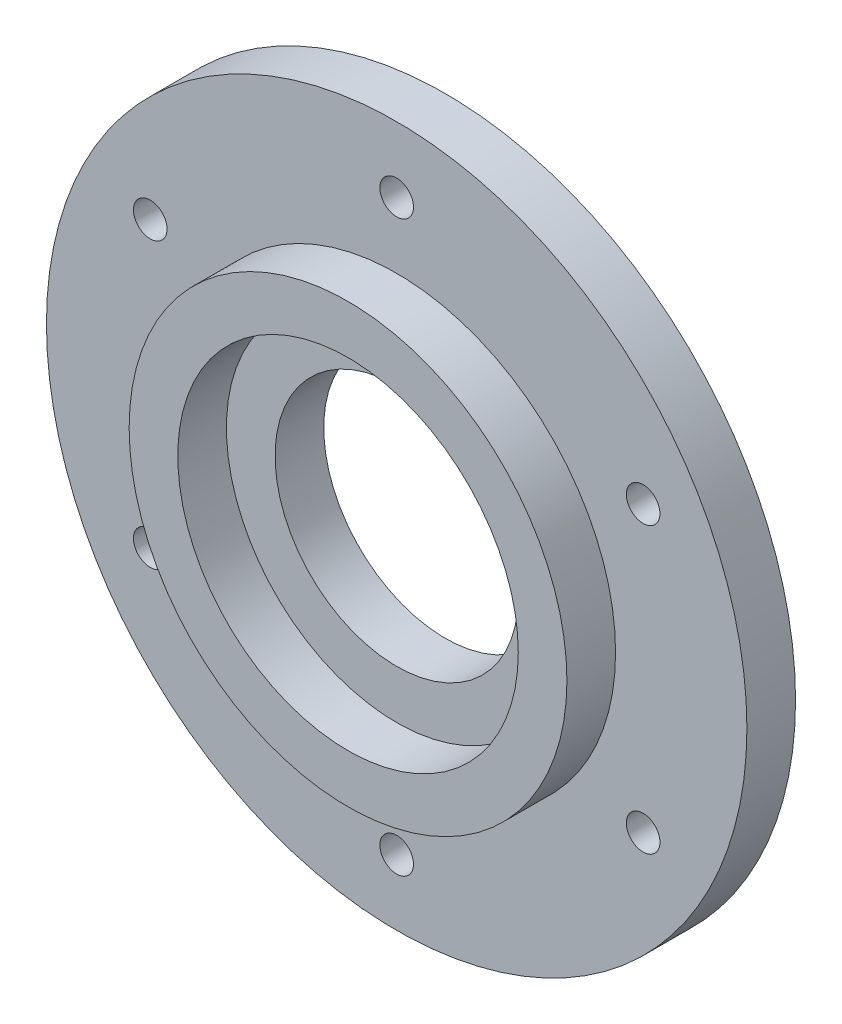
from build123d import *

# Parameters (mm, degrees)
SKETCH_CENTER_CUT_R                                 = 12.5
CUT_CENTER_DEPTH                                    = 52.15662225
CBORE_FOR_5_BINDING_HEAD_MACHINE_SCREW1_D           = 3.4544
CBORE_FOR_5_BINDING_HEAD_MACHINE_SCREW1_CBORE_D     = 7.54126
CBORE_FOR_5_BINDING_HEAD_MACHINE_SCREW1_CBORE_DEPTH = 1.9812
CIRPATTERN1_COUNT                                   = 6


with BuildPart() as part:
    # Sketch Spindle Skeleton → Main Revolve (revolve)
    with BuildSketch(Plane(origin=(0, 0, 0), x_dir=(0, 0, -1), z_dir=(1, 0, 0))):
        Polygon((-29.2, 17.5), (-24.2, 17.5), (-24.2, 9.5), (-19.2, 9.5), (-19.2, 36), (-24.2, 36), (-24.2, 22.5), (-29.2, 22.5), align=None)
    revolve(axis=Axis((0, 0, 1000), (0, 0, -1)))

    # Sketch Center Cut → Cut Center (cut, through all)
    with BuildSketch(Plane.XY.offset(24.2)):
        Circle(SKETCH_CENTER_CUT_R)
    extrude(amount=-CUT_CENTER_DEPTH, mode=Mode.SUBTRACT)

    # CBORE for #5 Binding Head Machine Screw1 (through all)
    with Locations(Plane(origin=(0, 0, 19.2), x_dir=(-1, 0, 0), z_dir=(0, 0, -1))):
        with Locations((0, 29.25)):
            cbore_for_5_binding_head_machine_screw1 = CounterBoreHole(CBORE_FOR_5_BINDING_HEAD_MACHINE_SCREW1_D / 2, CBORE_FOR_5_BINDING_HEAD_MACHINE_SCREW1_CBORE_D / 2, CBORE_FOR_5_BINDING_HEAD_MACHINE_SCREW1_CBORE_DEPTH)

    # CirPattern1: CBORE for #5 Binding Head Machine Screw1 ×6 about axis
    cirpattern1_axis = Axis((0, 0, 19.2), (0, 0, 1))
    for i in range(1, CIRPATTERN1_COUNT):
        add(cbore_for_5_binding_head_machine_screw1.rotate(cirpattern1_axis, i * 360 / CIRPATTERN1_COUNT), mode=Mode.SUBTRACT)


solid = part.part
